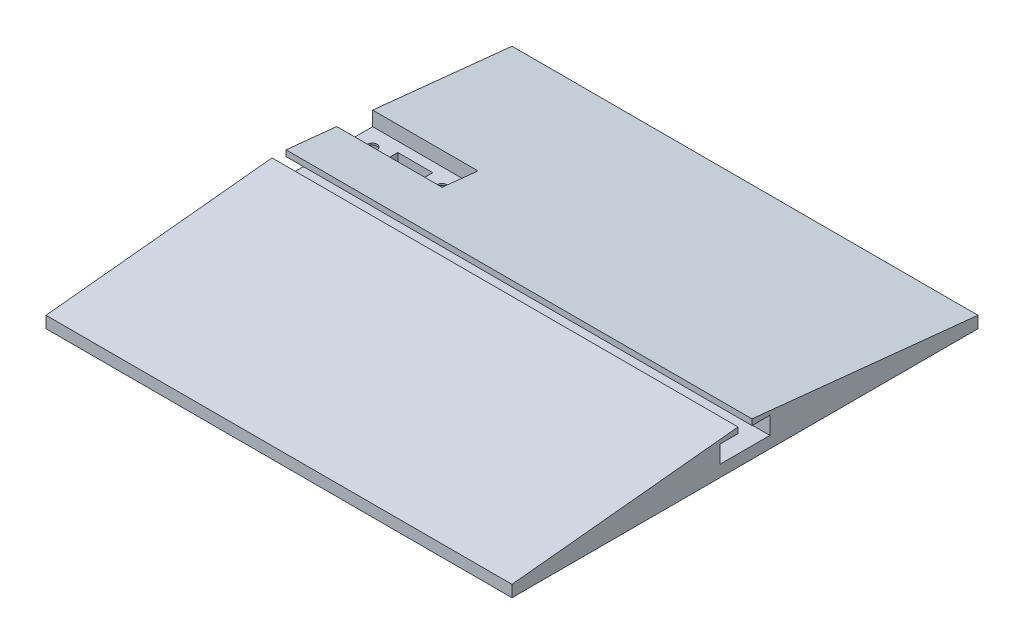
from build123d import *

# Parameters (mm, degrees)
SKETCH1_W           = 200
SKETCH1_H           = 200
BOSS_EXTRUDE1_DEPTH = 5
SKETCH8_W           = 15
SKETCH8_H           = 7
CUT_EXTRUDE4_DEPTH  = 142.509716981
BOSS_EXTRUDE2_DEPTH = 200
CUT_EXTRUDE6_REACH  = 143.774
SKETCH10_W          = 45.2
SKETCH10_H          = 15.4
CUT_EXTRUDE7_START  = -0.7
CUT_EXTRUDE7_DEPTH  = 3.6
SKETCH12_R          = 2.1
CUT_EXTRUDE8_DEPTH  = 142.774468788
CUT_EXTRUDE9_START  = -200
SKETCH13_W          = 21.4
SKETCH13_H          = 7.5
CUT_EXTRUDE9_DEPTH  = 200
CUT_EXTRUDE12_DEPTH = 3
FILLET1_R           = 8
CHAMFER1_SIZE2      = 6
CHAMFER1_SIZE       = 3


with BuildPart() as part:
    # Sketch1 → Boss-Extrude1 (new body)
    with BuildSketch(Plane(origin=(0, 0, 0), x_dir=(1, 0, 0), z_dir=(0, 1, 0))):
        Rectangle(SKETCH1_W, SKETCH1_H)
    extrude(amount=BOSS_EXTRUDE1_DEPTH)

    # Sketch8 → Cut-Extrude4 (cut, through all)
    with BuildSketch(Plane(origin=(0, 5, 0), x_dir=(1, 0, 0), z_dir=(0, 1, 0))):
        with Locations((-77.5, 32.5)):
            Rectangle(SKETCH8_W, SKETCH8_H)
    extrude(amount=-CUT_EXTRUDE4_DEPTH, mode=Mode.SUBTRACT)

    # Sketch9 → Boss-Extrude2 (add)
    with BuildSketch(Plane(origin=(100, 0, 0), x_dir=(0, 0, -1), z_dir=(1, 0, 0))):
        Polygon((-100, 5), (-3, 15), (-3, 5), align=None)
        Polygon((3, 5), (100, 5), (3, 15), align=None)
    extrude(amount=-BOSS_EXTRUDE2_DEPTH)

    # Cut-Extrude6: up to this plane
    cut_extrude6_end = Plane(origin=(-197.514101544, 5, -100), z_dir=(0, 0.9947279261542806, -0.1025492707375547))
    # Sketch10 → Cut-Extrude6 (cut, up to the surface)
    with BuildSketch(Plane(origin=(0, 5, 0), x_dir=(1, 0, 0), z_dir=(0, 1, 0)), mode=Mode.PRIVATE) as cut_extrude6_sk1:
        with Locations((-77.4, 32.5)):
            Rectangle(SKETCH10_W, SKETCH10_H)
    cut_extrude6_tool1 = split(extrude(cut_extrude6_sk1.sketch, amount=CUT_EXTRUDE6_REACH, mode=Mode.PRIVATE), bisect_by=cut_extrude6_end, keep=Keep.BOTH, mode=Mode.PRIVATE)
    add(cut_extrude6_tool1.solids().sort_by_distance((-77.4, 5, -32.5))[0], mode=Mode.SUBTRACT)

    # Sketch11 → Cut-Extrude7 (cut)
    with BuildSketch(Plane(origin=(0, 5, 0), x_dir=(1, 0, 0), z_dir=(0, 1, 0)).offset(CUT_EXTRUDE7_START)):
        Polygon((-92.5, 36.772391992), (-96.2, 34.636195996), (-96.2, 30.363804004), (-92.5, 28.227608008), (-88.8, 30.363804004), (-88.8, 34.636195996), align=None)
        Polygon((-62.5, 36.772391992), (-66.2, 34.636195996), (-66.2, 30.363804004), (-62.5, 28.227608008), (-58.8, 30.363804004), (-58.8, 34.636195996), align=None)
    extrude(amount=-CUT_EXTRUDE7_DEPTH, mode=Mode.SUBTRACT)

    # Sketch12 → Cut-Extrude8 (cut, through all)
    with BuildSketch(Plane(origin=(0, 5, 0), x_dir=(1, 0, 0), z_dir=(0, 1, 0))):
        with Locations(Location((-92.5, 32.5, 0), (0, 0, 270))):
            Circle(SKETCH12_R)
        with Locations(Location((-62.5, 32.5, 0), (0, 0, 270))):
            Circle(SKETCH12_R)
    extrude(amount=-CUT_EXTRUDE8_DEPTH, mode=Mode.SUBTRACT)

    # Sketch13 → Cut-Extrude9 (cut)
    with BuildSketch(Plane.ZY.offset(100).offset(CUT_EXTRUDE9_START)):
        with Locations((0, 8.75)):
            Rectangle(SKETCH13_W, SKETCH13_H)
    extrude(amount=CUT_EXTRUDE9_DEPTH, mode=Mode.SUBTRACT)

    # Sketch16 → Cut-Extrude12 (cut)
    with BuildSketch(Plane.XZ):
        Polygon((-85, -29), (-85, -13), (-55, -13), (-55, -21), (-70, -21), (-70, -29), align=None)
    extrude(amount=-CUT_EXTRUDE12_DEPTH, mode=Mode.SUBTRACT)

    # Fillet1
    fillet1_edges = [part.edges().sort_by_distance(p)[0] for p in [
        (-70, 1.5, -21),
        (-85, 1.5, -13),
    ]]
    fillet(fillet1_edges, radius=FILLET1_R)

    # Chamfer1
    chamfer1_edges = [part.edges().sort_by_distance(p)[0] for p in [
        (-55, 0, -17),
    ]]
    chamfer1_side = [part.faces().sort_by_distance(p)[0] for p in [
        (-55, 0.06, -17),
    ]]
    chamfer(chamfer1_edges, length=CHAMFER1_SIZE - 0.0001, length2=CHAMFER1_SIZE2 - 0.0001, reference=chamfer1_side[0])  # a hair under: the kernel refuses the full size


solid = part.part
